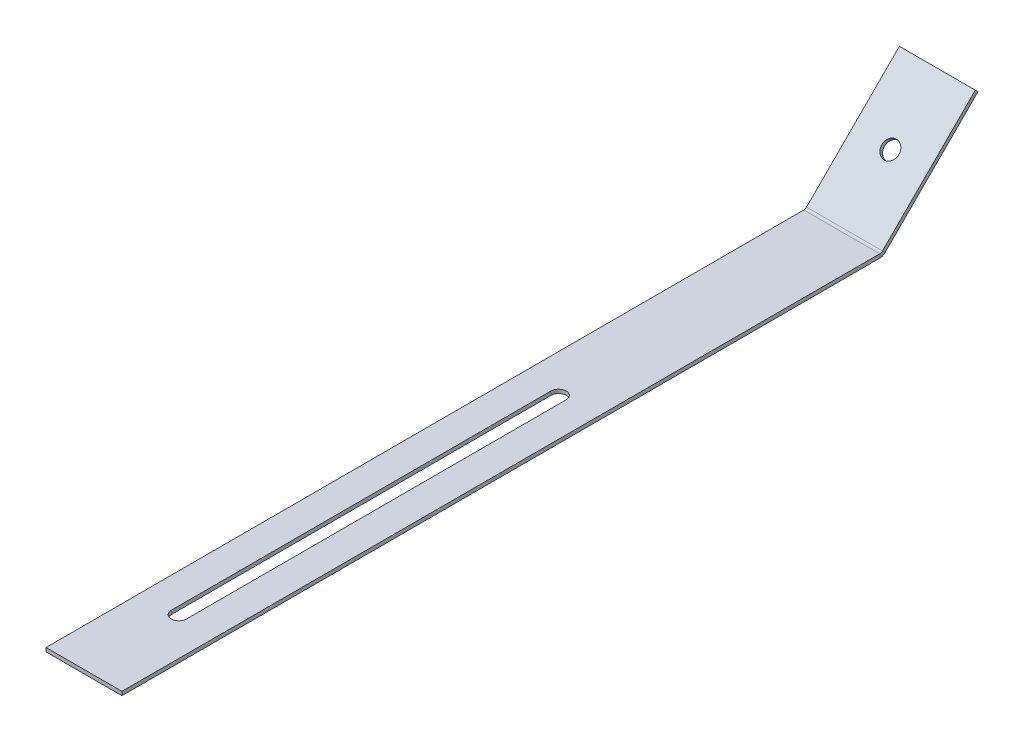
from build123d import *

# Parameters (mm, degrees)
BASE_FLANGE1_DEPTH = 40
SKETCH7_R          = 4.5
CUT_EXTRUDE1_DEPTH = 2
CUT_EXTRUDE2_DEPTH = 2


# Sheet-metal steps are written as plain solids
with BuildPart() as part:
    # Sketch1 → Base-Flange1 (new body)
    with BuildSketch(Plane(origin=(0, 0, 0), x_dir=(0, 0, -1), z_dir=(1, 0, 0))):
        with BuildLine():
            Line((0, 0), (399.171572875, 0))
            ThreePointArc((399.171572875, 0), (399.93693974, 0.152240935), (400.585786438, 0.585786438))
            Line((400.585786438, 0.585786438), (449.497474683, 49.497474683))
            Line((449.497474683, 49.497474683), (450.911688245, 48.083261121))
            Line((450.911688245, 48.083261121), (402, -0.828427125))
            ThreePointArc((402, -0.828427125), (400.702306605, -1.69551813), (399.171572875, -2))
            Line((399.171572875, -2), (0, -2))
            Line((0, -2), (0, 0))
        make_face()
    extrude(amount=BASE_FLANGE1_DEPTH)

    # Sketch7 → Cut-Extrude1 (cut)
    with BuildSketch(Plane(origin=(0, -200, -200), x_dir=(1, 0, 0), z_dir=(0, 0.7071067811865456, 0.7071067811865496))):
        with Locations(Location((20, 317.842712475, 0), (0, 0, 270))):
            Circle(SKETCH7_R)
    extrude(amount=-CUT_EXTRUDE1_DEPTH, mode=Mode.SUBTRACT)

    # Sketch8 → Cut-Extrude2 (cut)
    with BuildSketch(Plane(origin=(0, 0, 0), x_dir=(1, 0, 0), z_dir=(0, 1, 0))):
        with BuildLine():
            Line((24, 50), (24, 250))
            ThreePointArc((24, 250), (20, 254), (16, 250))
            Line((16, 250), (16, 50))
            ThreePointArc((16, 50), (20, 46), (24, 50))
        make_face()
    extrude(amount=-CUT_EXTRUDE2_DEPTH, mode=Mode.SUBTRACT)


solid = part.part
